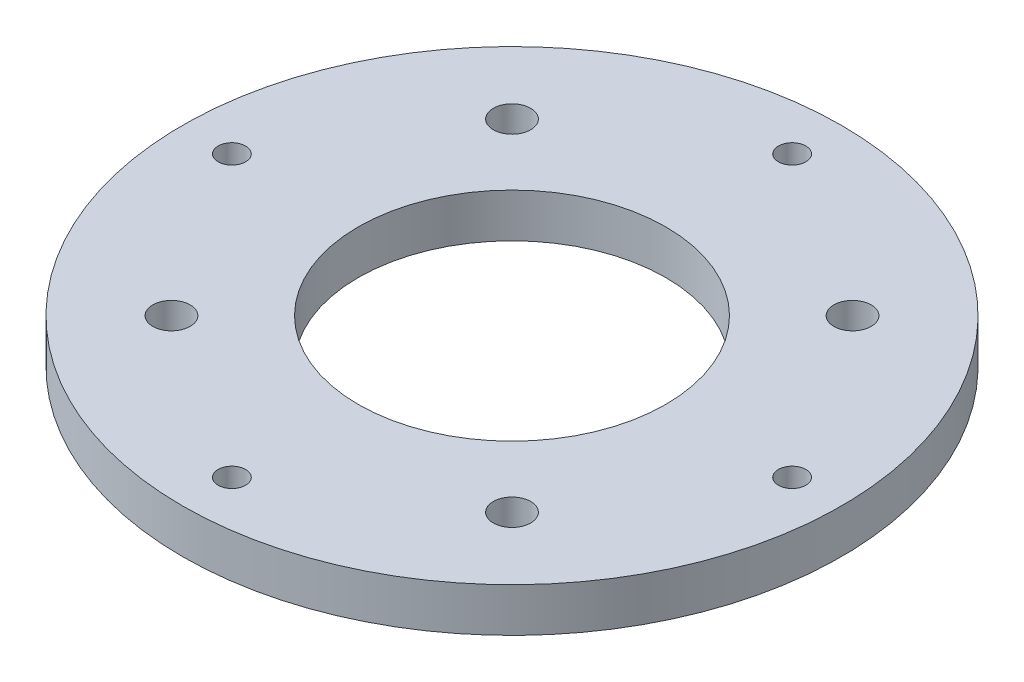
from build123d import *

# Parameters (mm, degrees)
SKETCH1_R                   = 30
BASE_FLANGE1_DEPTH          = 4
M3_TAPPED_BASE_D            = 2.5
M3_TAPPED_MOTOR_D           = 3.4
M3_TAPPED_MOTOR_CSINK_D     = 6.3
M3_TAPPED_MOTOR_CSINK_ANGLE = 90
SKETCH10_R                  = 14
CUT_EXTRUDE1_DEPTH          = 43.614551505


# Sheet-metal steps are written as plain solids
with BuildPart() as part:
    # Sketch1 → Base-Flange1 (new body)
    with BuildSketch(Plane(origin=(0, 0, 0), x_dir=(1, 0, 0), z_dir=(0, 1, 0))):
        with Locations(Location((0, 0, 0), (0, 0, 270))):
            Circle(SKETCH1_R)
    extrude(amount=-BASE_FLANGE1_DEPTH)

    # M3 Tapped base (through all)
    with Locations(Plane(origin=(0, 0, 0), x_dir=(1, 0, 0), z_dir=(0, 1, 0))):
        with Locations((0, 25.5), (25.5, 0), (0, -25.5), (-25.5, 0)):
            Hole(M3_TAPPED_BASE_D / 2)

    # M3 Tapped motor (through all)
    with Locations(Plane.XZ.offset(4)):
        with Locations((-15.5, -15.5), (15.5, 15.5), (-15.5, 15.5), (15.5, -15.5)):
            CounterSinkHole(M3_TAPPED_MOTOR_D / 2, M3_TAPPED_MOTOR_CSINK_D / 2, counter_sink_angle=M3_TAPPED_MOTOR_CSINK_ANGLE)

    # Sketch10 → Cut-Extrude1 (cut, through all)
    with BuildSketch(Plane(origin=(0, -4, 0), x_dir=(-1, 0, 0), z_dir=(0, -1, 0))):
        with Locations(Location((0, 0, 0), (0, 0, 90))):
            Circle(SKETCH10_R)
    extrude(amount=-CUT_EXTRUDE1_DEPTH, mode=Mode.SUBTRACT)


solid = part.part
